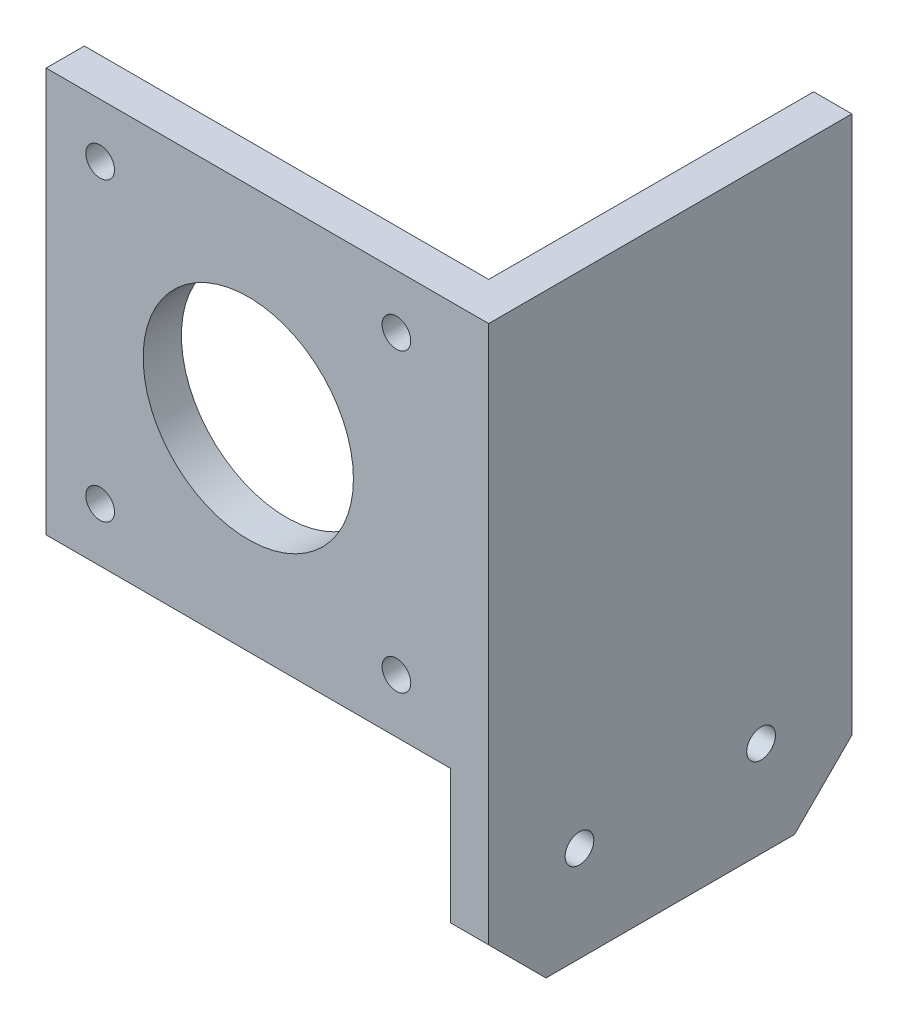
from build123d import *

# Parameters (mm, degrees)
SKETCH_1_W      = 42.3
SKETCH_1_H      = 42.3
SKETCH_1_R      = 11
SKETCH_1_R_2    = 1.5
EXTRUDE_1_DEPTH = 4
SKETCH_2_W      = 38
SKETCH_2_H      = 62.3
SKETCH_2_R      = 1.5
EXTRUDE_2_DEPTH = 4
CHAMFER_1_SIZE  = 6


with BuildPart() as part:
    # 스케치1 → 보스-돌출1 (new body)
    with BuildSketch(Plane.XY):
        Rectangle(SKETCH_1_W, SKETCH_1_H)
        Circle(SKETCH_1_R, mode=Mode.SUBTRACT)
        with Locations((-15.5, 15.5)):
            Circle(SKETCH_1_R_2, mode=Mode.SUBTRACT)
        with Locations((15.5, 15.5)):
            Circle(SKETCH_1_R_2, mode=Mode.SUBTRACT)
        with Locations((15.5, -15.5)):
            Circle(SKETCH_1_R_2, mode=Mode.SUBTRACT)
        with Locations((-15.5, -15.5)):
            Circle(SKETCH_1_R_2, mode=Mode.SUBTRACT)
    extrude(amount=EXTRUDE_1_DEPTH)

    # 스케치2 → 보스-돌출2 (add)
    with BuildSketch(Plane(origin=(21.15, 0, 0), x_dir=(0, 0, -1), z_dir=(1, 0, 0))):
        with Locations((15, -10)):
            Rectangle(SKETCH_2_W, SKETCH_2_H)
        with Locations((5.5, -31.15)):
            Circle(SKETCH_2_R, mode=Mode.SUBTRACT)
        with Locations((24.5, -31.15)):
            Circle(SKETCH_2_R, mode=Mode.SUBTRACT)
    extrude(amount=EXTRUDE_2_DEPTH)

    # 모따기1
    chamfer_1_edges = [part.edges().sort_by_distance(p)[0] for p in [
        (23.15, -41.15, -34),
        (23.15, -41.15, 4),
    ]]
    chamfer(chamfer_1_edges, length=CHAMFER_1_SIZE)


solid = part.part
